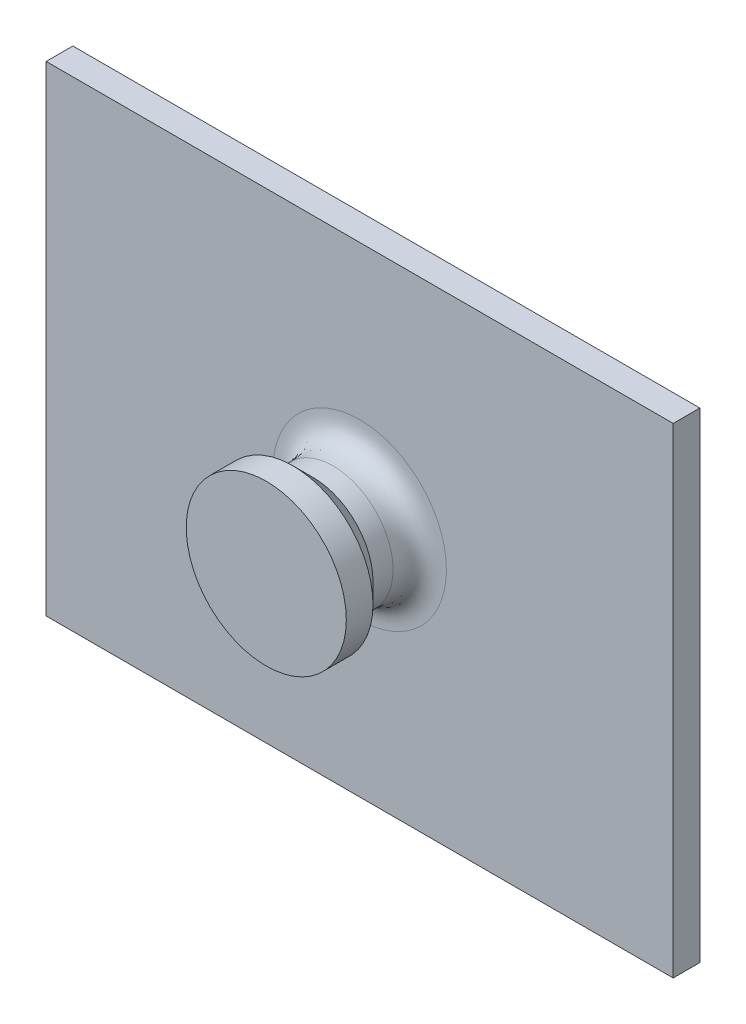
from build123d import *

# Parameters (mm, degrees)
SKETCH1_W           = 47
SKETCH1_H           = 36
BOSS_EXTRUDE1_DEPTH = 2
SKETCH2_R           = 4.5
BOSS_EXTRUDE2_DEPTH = 5
SKETCH3_R           = 6
BOSS_EXTRUDE3_DEPTH = 2
FILLET1_SIZE        = 2
CHAMFER1_SIZE       = 1.5


# Some blends are built 0.0001 mm under size
with BuildPart() as part:
    # Sketch1 → Boss-Extrude1 (new body)
    with BuildSketch(Plane.XY):
        with Locations((23.5, 28.347826087)):
            Rectangle(SKETCH1_W, SKETCH1_H)
    extrude(amount=BOSS_EXTRUDE1_DEPTH)

    # Sketch2 → Boss-Extrude2 (add)
    with BuildSketch(Plane.XY.offset(2)):
        with Locations((23.5, 28.347826087)):
            Circle(SKETCH2_R)
    extrude(amount=BOSS_EXTRUDE2_DEPTH)

    # Sketch3 → Boss-Extrude3 (add)
    with BuildSketch(Plane.XY.offset(7)):
        with Locations((23.5, 28.347826087)):
            Circle(SKETCH3_R)
    extrude(amount=BOSS_EXTRUDE3_DEPTH)

    # Fillet1
    # a fillet whose section is not a circle: 2 mm, written as the material it adds along each edge
    with BuildSketch(Plane(origin=(23.5, 28.347826087, 2), x_dir=(1, 0, 0), z_dir=(0, -1, 0))) as fillet1_piece_1:
        with BuildLine():
            add(Edge.make_bspline([(4.5, FILLET1_SIZE), (4.5, FILLET1_SIZE * 0.831801948466), (4.5, FILLET1_SIZE * 0.663603896932), (4.5 + FILLET1_SIZE * 0.0716919198361, FILLET1_SIZE * 0.292893218813), (4.5 + FILLET1_SIZE * 0.292893218813, FILLET1_SIZE * 0.0716919198361), (4.5 + FILLET1_SIZE * 0.663603896932, 0), (4.5 + FILLET1_SIZE * 0.831801948466, 0), (4.5 + FILLET1_SIZE, 0)], knots=[0, 0, 0, 0, 0, 0, 0.5, 0.5, 1, 1, 1, 1, 1, 1], degree=5))
            Line((4.5 + FILLET1_SIZE, 0), (4.5, 0))
            Line((4.5, 0), (4.5, FILLET1_SIZE))
        make_face()
    revolve(axis=Axis((23.5, 28.347826087, 2), (0, 0, 1)))

    # Chamfer1
    chamfer1_edges = [part.edges().sort_by_distance(p)[0] for p in [
        (19, 28.347826087, 7),
    ]]
    chamfer(chamfer1_edges, length=CHAMFER1_SIZE - 0.0001)  # a hair under: the kernel refuses the full size


solid = part.part
